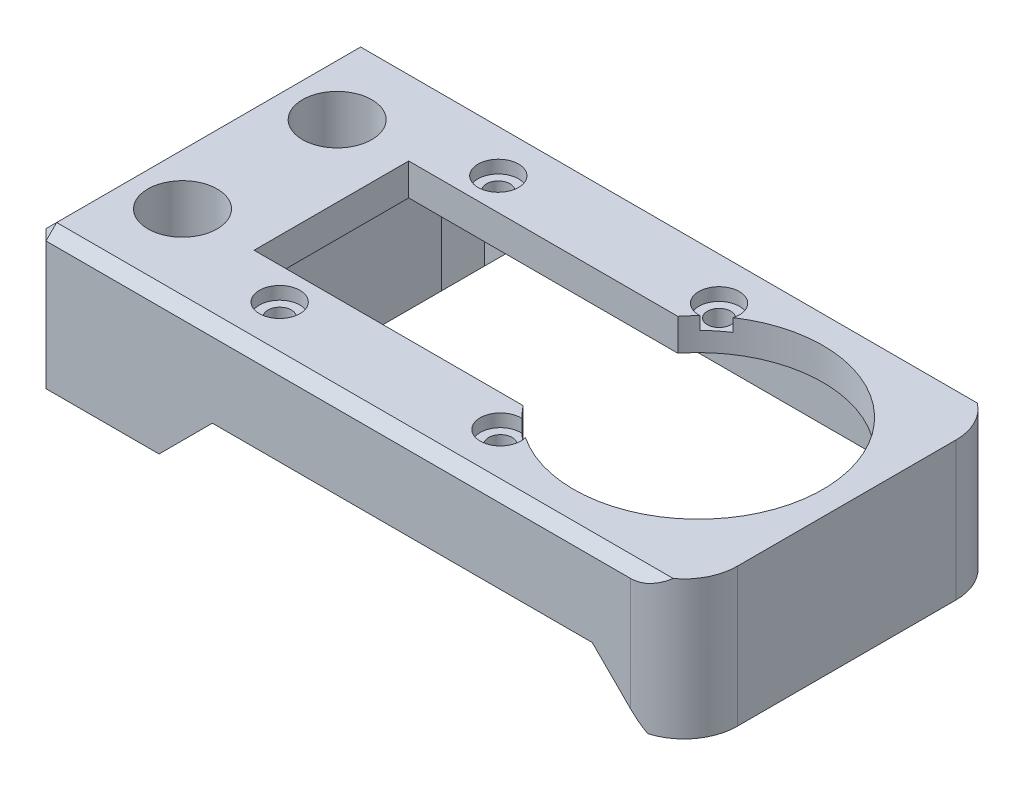
from build123d import *

# Parameters (mm, degrees)
ESQUISSE1_W                                        = 53.8
ESQUISSE1_H                                        = 26.5
ESQUISSE1_R                                        = 1.1
BOSS_EXTRU_1_DEPTH                                 = 3
CHAMBRAGE_POUR_VIS_SIX_PANS_CREUX_M1_6_D           = 2.2
CHAMBRAGE_POUR_VIS_SIX_PANS_CREUX_M1_6_CBORE_D     = 3.8
CHAMBRAGE_POUR_VIS_SIX_PANS_CREUX_M1_6_CBORE_DEPTH = 1.2
BOSS_EXTRU_2_START                                 = 16
BOSS_EXTRU_2_DEPTH                                 = 19
ESQUISSE6_W                                        = 11.6
ESQUISSE6_H                                        = 6
ENL_V_MAT_EXTRU_1_DEPTH                            = 60.582531836
ENL_V_MAT_EXTRU_2_DEPTH                            = 58.559344159
ENL_V_MAT_EXTRU_2_DEPTH_BACK                       = 58.559344159
ESQUISSE7_R                                        = 1.6
PER_AGEAVANC_1_START                               = -4
PER_AGEAVANC_1_OUTLINE_R                           = 3.25
PER_AGEAVANC_1_OUTLINE_R_2                         = 1.6
PER_AGEAVANC_1_DEPTH                               = 7
BOSS_EXTRU_3_DEPTH                                 = 2
ESQUISSE11_R                                       = 3.860993261
BOSS_EXTRU_4_DEPTH                                 = 13
ESQUISSE12_W                                       = 8
ESQUISSE12_H                                       = 30.5
ENL_V_MAT_EXTRU_3_DEPTH                            = 59.404435619
CHANFREIN1_SIZE                                    = 1
CONG_1_R                                           = 5
CHANFREIN2_SIZE                                    = 2


with BuildPart() as part:
    # Esquisse1 → Boss.-Extru.1 (new body)
    with BuildSketch(Plane(origin=(0, 0, 0), x_dir=(1, 0, 0), z_dir=(0, 1, 0))):
        with Locations((16.5, 10.25)):
            Rectangle(ESQUISSE1_W, ESQUISSE1_H)
        with Locations(Location((0, 0, 0), (0, 0, 270))):
            Circle(ESQUISSE1_R, mode=Mode.SUBTRACT)
        with Locations(Location((20.7, 0, 0), (0, 0, 270))):
            Circle(ESQUISSE1_R, mode=Mode.SUBTRACT)
        with Locations(Location((0, 20.5, 0), (0, 0, 270))):
            Circle(ESQUISSE1_R, mode=Mode.SUBTRACT)
        with BuildLine():
            Line((-5.4, 3), (-5.4, 17.5))
            Line((-5.4, 17.5), (19.829743733, 17.5))
            ThreePointArc((19.829743733, 17.5), (32.837694897, 21.29211021), (40.69, 10.25))
            ThreePointArc((40.69, 10.25), (32.837694897, -0.79211021), (19.829743733, 3))
            Line((19.829743733, 3), (-5.4, 3))
        make_face(mode=Mode.SUBTRACT)
        with Locations(Location((20.7, 20.5, 0), (0, 0, 270))):
            Circle(ESQUISSE1_R, mode=Mode.SUBTRACT)
    extrude(amount=BOSS_EXTRU_1_DEPTH)

    # Chambrage pour vis à six pans creux M1.61 (through all)
    with Locations(Plane(origin=(0, 3, 0), x_dir=(1, 0, 0), z_dir=(0, 1, 0))):
        with Locations((0, 20.5), (20.7, 20.5), (20.7, 0), (0, 0)):
            CounterBoreHole(CHAMBRAGE_POUR_VIS_SIX_PANS_CREUX_M1_6_D / 2, CHAMBRAGE_POUR_VIS_SIX_PANS_CREUX_M1_6_CBORE_D / 2, CHAMBRAGE_POUR_VIS_SIX_PANS_CREUX_M1_6_CBORE_DEPTH)

    # Esquisse4 → Boss.-Extru.2 (add)
    with BuildSketch(Plane.XZ.offset(BOSS_EXTRU_2_START)):
        Polygon((-10.4, 3), (-17.91, 3), (-17.91, -23.5), (-10.4, -23.5), (-6.31, -23.5), (-6.31, 3), align=None)
        with BuildLine():
            Line((39.31, 3), (50.91, 3))
            Line((50.91, 3), (50.91, -23.5))
            Line((50.91, -23.5), (39.31, -23.5))
            Line((39.31, -23.5), (39.31, -15.759990926))
            ThreePointArc((39.31, -15.759990926), (40.69, -10.25), (39.31, -4.740009074))
            Line((39.31, -4.740009074), (39.31, 3))
        make_face()
    extrude(amount=-BOSS_EXTRU_2_DEPTH)

    # Esquisse6 → Enlèv. mat.-Extru.1 (cut, through all)
    with BuildSketch(Plane(origin=(0, 0, -23.5), x_dir=(-1, 0, 0), z_dir=(0, 0, -1))):
        with Locations((12.11, -13)):
            Rectangle(ESQUISSE6_W, ESQUISSE6_H)
        with Locations((-45.11, -13)):
            Rectangle(ESQUISSE6_W, ESQUISSE6_H)
    extrude(amount=-ENL_V_MAT_EXTRU_1_DEPTH, mode=Mode.SUBTRACT)

    # Esquisse7 → Enlèv. mat.-Extru.2 (cut, two sides: drawn at the far end of the back side and taken through both)
    with BuildSketch(Plane.XZ.offset(10).offset(-ENL_V_MAT_EXTRU_2_DEPTH_BACK)):
        with Locations(Location((-12.11, -3, 0), (0, 0, 270))):
            Circle(ESQUISSE7_R)
        with Locations(Location((-12.11, -17.5, 0), (0, 0, 270))):
            Circle(ESQUISSE7_R)
        with Locations(Location((45.11, -10.25, 0), (0, 0, 270))):
            Circle(ESQUISSE7_R)
    extrude(amount=ENL_V_MAT_EXTRU_2_DEPTH + ENL_V_MAT_EXTRU_2_DEPTH_BACK, mode=Mode.SUBTRACT)

    # PerçageAvancé1: read off the stored shape, not the designer's step
    # PerçageAvancé1 outline → PerçageAvancé1 (cut)
    # profile 1 of 3: a face of its own
    with BuildSketch(Plane(origin=(0, 0, 0), x_dir=(1, 0, 0), z_dir=(0, 1, 0)).offset(PER_AGEAVANC_1_START)):
        with Locations((-12.11, 17.5)):
            Circle(PER_AGEAVANC_1_OUTLINE_R)
        with Locations((-12.11, 17.5)):
            Circle(PER_AGEAVANC_1_OUTLINE_R_2, mode=Mode.SUBTRACT)
    # profile 2 of 3: a face of its own
    with BuildSketch(Plane(origin=(0, 0, 0), x_dir=(1, 0, 0), z_dir=(0, 1, 0)).offset(PER_AGEAVANC_1_START)):
        with Locations((-12.11, 3)):
            Circle(PER_AGEAVANC_1_OUTLINE_R)
        with Locations((-12.11, 3)):
            Circle(PER_AGEAVANC_1_OUTLINE_R_2, mode=Mode.SUBTRACT)
    # profile 3 of 3: a face of its own
    with BuildSketch(Plane(origin=(0, 0, 0), x_dir=(1, 0, 0), z_dir=(0, 1, 0)).offset(PER_AGEAVANC_1_START)):
        with Locations((45.11, 10.25)):
            Circle(PER_AGEAVANC_1_OUTLINE_R)
        with Locations((45.11, 10.25)):
            Circle(PER_AGEAVANC_1_OUTLINE_R_2, mode=Mode.SUBTRACT)
    extrude(amount=PER_AGEAVANC_1_DEPTH, mode=Mode.SUBTRACT)

    # Esquisse10 → Boss.-Extru.3 (add)
    with BuildSketch(Plane.XY.offset(3)):
        Polygon((-6.31, -10), (-1.31, -5), (34.31, -5), (39.31, -10), (50.91, -10), (50.91, 3), (-17.91, 3), (-17.91, -10), align=None)
    boss_extru_3 = extrude(amount=BOSS_EXTRU_3_DEPTH)

    # Symétrie1: Boss.-Extru.3 across plane
    add(boss_extru_3.mirror(Plane.XY.offset(-10.25)))

    # Esquisse11 → Boss.-Extru.4 (add)
    with BuildSketch(Plane(origin=(0, 3, 0), x_dir=(1, 0, 0), z_dir=(0, 1, 0))):
        with Locations((45.11, 10.25)):
            Circle(ESQUISSE11_R)
    extrude(amount=-BOSS_EXTRU_4_DEPTH)

    # Esquisse12 → Enlèv. mat.-Extru.3 (cut, through all)
    with BuildSketch(Plane(origin=(0, 3, 0), x_dir=(1, 0, 0), z_dir=(0, 1, 0))):
        with Locations((46.91, 10.25)):
            Rectangle(ESQUISSE12_W, ESQUISSE12_H)
    extrude(amount=-ENL_V_MAT_EXTRU_3_DEPTH, mode=Mode.SUBTRACT)

    # Chanfrein1
    chanfrein1_edges = [part.edges().sort_by_distance(p)[0] for p in [
        (-17.91, -3.5, 5),
        (-17.91, -3.5, -25.5),
        (12.5, 3, -25.5),
        (12.5, 3, 5),
        (-17.91, 3, -10.25),
    ]]
    chamfer(chanfrein1_edges, length=CHANFREIN1_SIZE)

    # Congé1
    cong_1_edges = [part.edges().sort_by_distance(p)[0] for p in [
        (42.91, -4, -25.5),
        (42.91, -4, 5),
    ]]
    fillet(cong_1_edges, radius=CONG_1_R)

    # Chanfrein2
    chanfrein2_edges = [part.edges().sort_by_distance(p)[0] for p in [
        (-6.31, -5, -23.5),
        (-6.31, -5, 3),
        (39.31, -5, 3),
        (39.31, -5, -23.5),
    ]]
    chamfer(chanfrein2_edges, length=CHANFREIN2_SIZE)


solid = part.part
